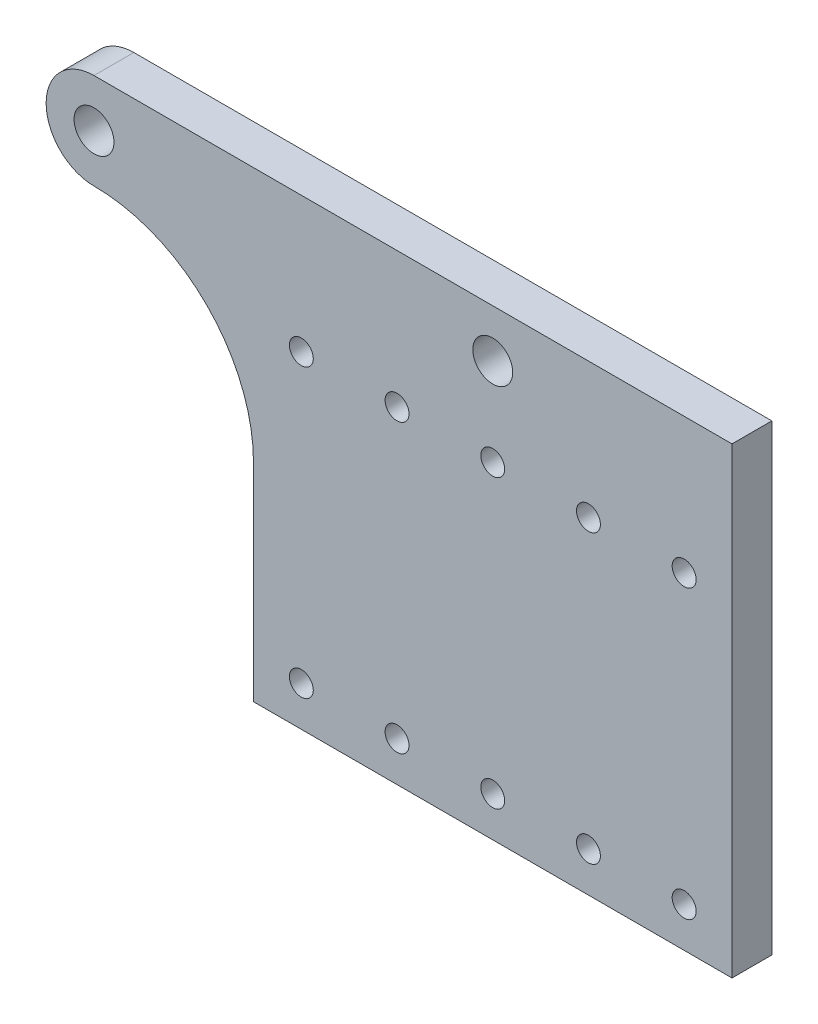
from build123d import *

# Parameters (mm, degrees)
SKETCH_1_R             = 2.5
EXTRUDE_1_DEPTH        = 5
CUT_EXTRUDE_1_REACH    = 74.643
SKETCH_2_R             = 1.5
PATTERN_LINEAR_1_COUNT = 5
PATTERN_LINEAR_1_PITCH = 12
FILLET_1_R             = 20


with BuildPart() as part:
    # 草圖1 → 填料-伸長1 (new body)
    with BuildSketch(Plane.XY):
        with BuildLine():
            Line((-30, 0), (-30, -46))
            Line((-30, -46), (30, -46))
            Line((30, -46), (30, 0))
            Line((30, 0), (30, 12))
            Line((30, 12), (-50, 12))
            ThreePointArc((-50, 12), (-56, 6), (-50, 0))
            Line((-50, 0), (-30, 0))
        make_face()
        with Locations((0, 6)):
            Circle(SKETCH_1_R, mode=Mode.SUBTRACT)
        with Locations((-50, 6)):
            Circle(SKETCH_1_R, mode=Mode.SUBTRACT)
    extrude(amount=EXTRUDE_1_DEPTH)

    # 草圖2 → 除料-伸長1 (cut, up to next)
    with BuildSketch(Plane.XY.offset(5), mode=Mode.PRIVATE) as cut_extrude_1_sk1:
        with Locations((-24, -5)):
            Circle(SKETCH_2_R)
    cut_extrude_1_tool1 = extrude(cut_extrude_1_sk1.sketch, amount=-CUT_EXTRUDE_1_REACH, mode=Mode.PRIVATE) & part.part
    # 草圖2 → 除料-伸長1 (cut, up to next)
    with BuildSketch(Plane.XY.offset(5), mode=Mode.PRIVATE) as cut_extrude_1_sk2:
        with Locations((-24, -41)):
            Circle(SKETCH_2_R)
    cut_extrude_1_tool2 = extrude(cut_extrude_1_sk2.sketch, amount=-CUT_EXTRUDE_1_REACH, mode=Mode.PRIVATE) & part.part
    cut_extrude_1_1 = cut_extrude_1_tool1.solids().sort_by_distance((-24, -5, 5))[0]
    add(cut_extrude_1_1, mode=Mode.SUBTRACT)
    cut_extrude_1_2 = cut_extrude_1_tool2.solids().sort_by_distance((-24, -41, 5))[0]
    add(cut_extrude_1_2, mode=Mode.SUBTRACT)
    cut_extrude_1 = cut_extrude_1_1 + cut_extrude_1_2  # 除料-伸長1 as one shape, for the pattern or mirror that repeats it

    # 直線複製排列1: 除料-伸長1 ×5
    with Locations(*[(i * PATTERN_LINEAR_1_PITCH, 0, 0) for i in range(1, PATTERN_LINEAR_1_COUNT)]):
        add(cut_extrude_1, mode=Mode.SUBTRACT)

    # 圓角1
    fillet_1_edges = [part.edges().sort_by_distance(p)[0] for p in [
        (-30, 0, 2.5),
    ]]
    fillet(fillet_1_edges, radius=FILLET_1_R - 0.0001)  # a hair under: the kernel refuses the full size


solid = part.part
